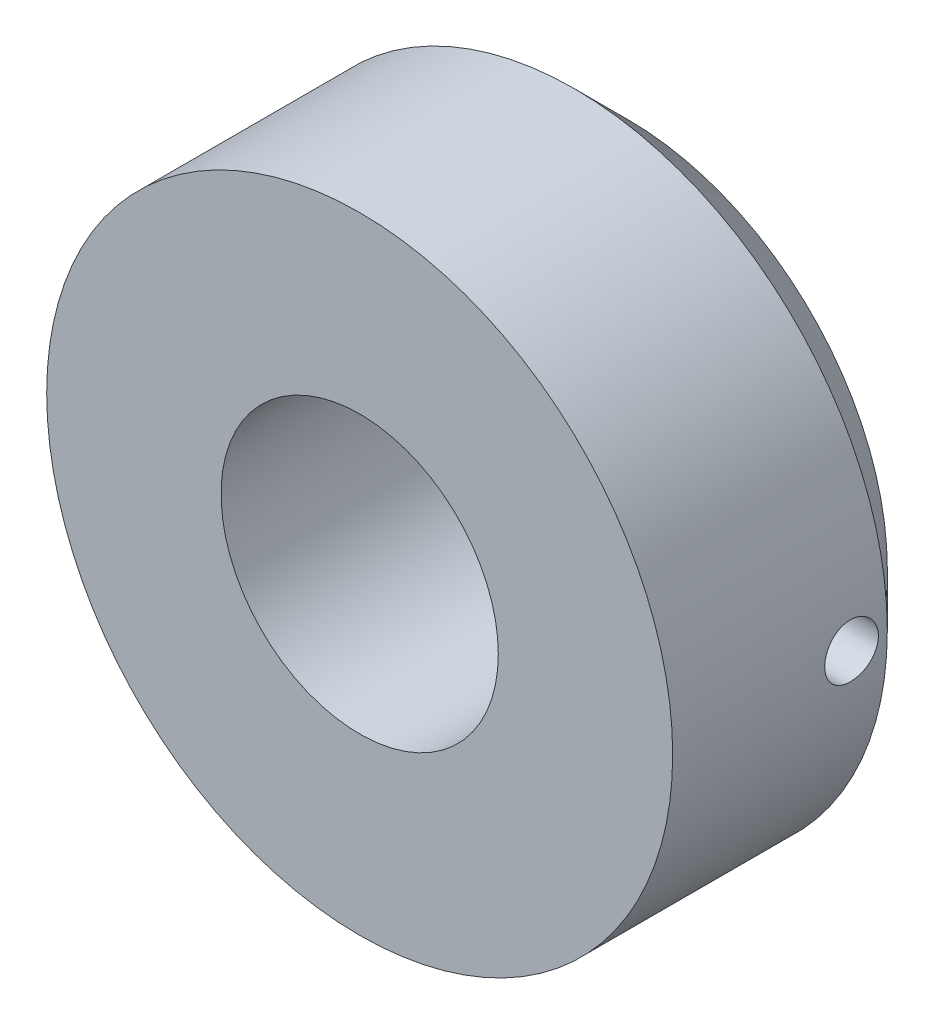
from build123d import *

# Parameters (mm, degrees)
BOSS_EXTRUDE1_DEPTH             = 10
BOSS_EXTRUDE1_DEPTH_BACK        = 5
SKETCH1_R                       = 17.5
SKETCH1_R_2                     = 8.75
SKETCH2_R                       = 1.5
CUT_EXTRUDE1_DEPTH              = 27.69269563
SKETCH3_R                       = 1.5
CUT_EXTRUDE2_DEPTH              = 27.692695815
CHAMFER1_SIZE                   = 3
BOSS_EXTRUDE2_REACH             = 28.693
SKETCH4_R                       = 8.75
SKETCH4_R_2                     = 7.75
BOSS_EXTRUDE2_DIRECTION_2_REACH = 28.693


with BuildPart() as part:
    # Sketch1 → Boss-Extrude1 (new, two sides: drawn at the far end of the back side and taken through both)
    with BuildSketch(Plane.XY.offset(-BOSS_EXTRUDE1_DEPTH_BACK)):
        Circle(SKETCH1_R)
        Circle(SKETCH1_R_2, mode=Mode.SUBTRACT)
    extrude(amount=BOSS_EXTRUDE1_DEPTH + BOSS_EXTRUDE1_DEPTH_BACK)

    # Sketch2 → Cut-Extrude1 (cut, through all)
    with BuildSketch(Plane(origin=(0, 0, 0), x_dir=(1, 0, 0), z_dir=(0, 1, 0))):
        Circle(SKETCH2_R)
    extrude(amount=-CUT_EXTRUDE1_DEPTH, mode=Mode.SUBTRACT)

    # Sketch3 → Cut-Extrude2 (cut, through all)
    with BuildSketch(Plane(origin=(0, 0, 0), x_dir=(0, 0, -1), z_dir=(1, 0, 0))):
        Circle(SKETCH3_R)
    extrude(amount=CUT_EXTRUDE2_DEPTH, mode=Mode.SUBTRACT)

    # Chamfer1
    chamfer1_edges = [part.edges().sort_by_distance(p)[0] for p in [
        (-17.5, 0, -5),
    ]]
    chamfer(chamfer1_edges, length=CHAMFER1_SIZE)

    # Boss-Extrude2: up to this face of the body (flat: up to its plane)
    boss_extrude2_end = Plane(part.part.faces().sort_by_distance((-17.005025253, 0, 10))[0])
    # Sketch4 → Boss-Extrude2 (add, up to the picked face)
    with BuildSketch(Plane.XY, mode=Mode.PRIVATE) as boss_extrude2_sk1:
        Circle(SKETCH4_R)
        Circle(SKETCH4_R_2, mode=Mode.SUBTRACT)
    boss_extrude2_tool1 = split(extrude(boss_extrude2_sk1.sketch, amount=BOSS_EXTRUDE2_REACH, mode=Mode.PRIVATE), bisect_by=boss_extrude2_end, keep=Keep.BOTH, mode=Mode.PRIVATE)
    add(boss_extrude2_tool1.solids().sort_by(Axis((-8.502513, 0, 0), (0, 0, 1)))[0])

    # Boss-Extrude2 direction 2: up to this face of the body (flat: up to its plane)
    boss_extrude2_direction_2_end = Plane(part.part.faces().sort_by_distance((-14.089878067, 0, -5))[0])
    # Sketch4 → Boss-Extrude2 direction 2 (add, up to the picked face)
    with BuildSketch(Plane.XY, mode=Mode.PRIVATE) as boss_extrude2_direction_2_sk1:
        Circle(SKETCH4_R)
        Circle(SKETCH4_R_2, mode=Mode.SUBTRACT)
    boss_extrude2_direction_2_tool1 = split(extrude(boss_extrude2_direction_2_sk1.sketch, amount=-BOSS_EXTRUDE2_DIRECTION_2_REACH, mode=Mode.PRIVATE), bisect_by=boss_extrude2_direction_2_end, keep=Keep.BOTH, mode=Mode.PRIVATE)
    add(boss_extrude2_direction_2_tool1.solids().sort_by(Axis((-8.502513, 0, 0), (0, 0, -1)))[0])


solid = part.part
